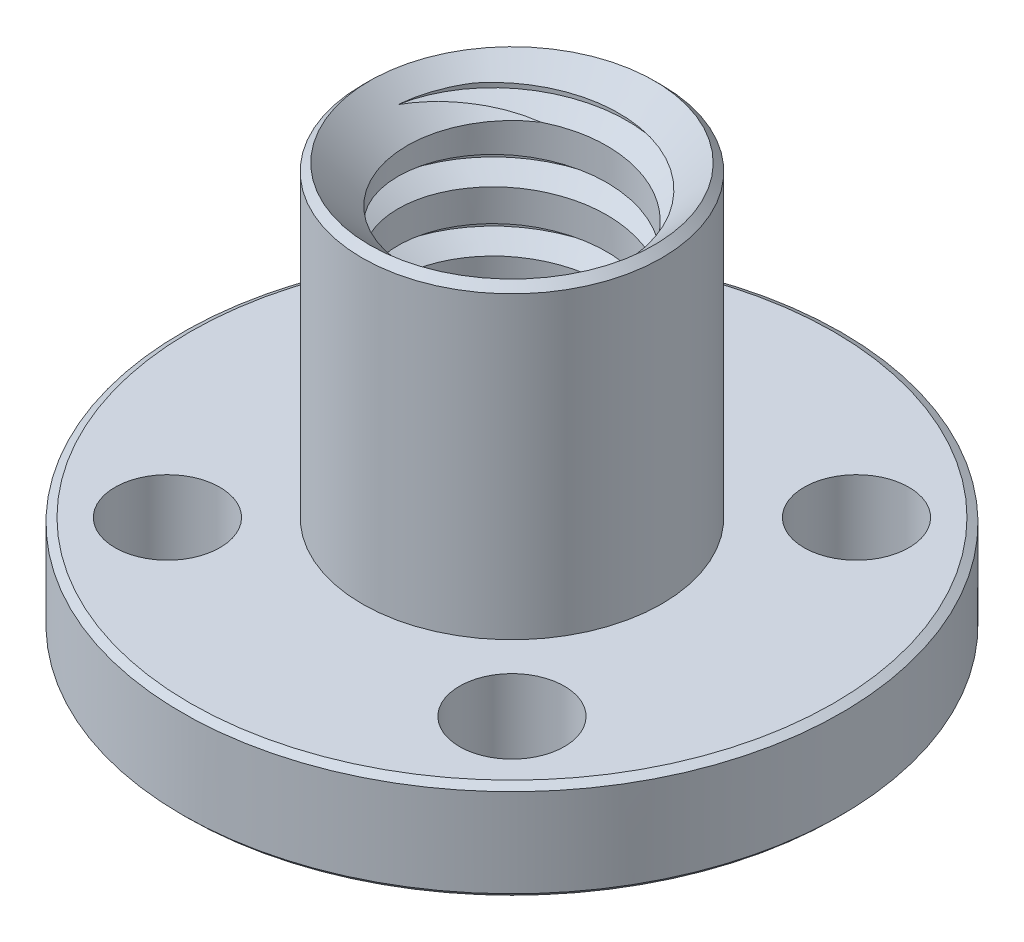
from build123d import *

# Parameters (mm, degrees)
SKETCH1_R           = 11
BOSS_EXTRUDE1_DEPTH = 3.25
SKETCH2_R           = 5
BOSS_EXTRUDE2_DEPTH = 1.5
BOSS_EXTRUDE3_START = 10.25
SKETCH3_R           = 5
BOSS_EXTRUDE3_DEPTH = 10.25
SKETCH4_R           = 1.75
CUT_EXTRUDE1_DEPTH  = 3.25
SKETCH5_R           = 3.5
CUT_EXTRUDE2_DEPTH  = 15
CHAMFER1_SIZE       = 0.25
CHAMFER2_SIZE       = 0.15
CHAMFER2_SIZE2      = 0.259807621
CHAMFER3_SIZE       = 0.15
THREAD1_PITCH       = 2


with BuildPart() as part:
    # Sketch1 → Boss-Extrude1 (new body)
    with BuildSketch(Plane(origin=(0, 0, 0), x_dir=(1, 0, 0), z_dir=(0, 1, 0))):
        with Locations(Location((0, 0, 0), (0, 0, 90))):
            Circle(SKETCH1_R)
    extrude(amount=BOSS_EXTRUDE1_DEPTH)

    # Sketch2 → Boss-Extrude2 (add)
    with BuildSketch(Plane.XZ):
        with Locations(Location((0, 0, 0), (0, 0, 270))):
            Circle(SKETCH2_R)
    extrude(amount=BOSS_EXTRUDE2_DEPTH)

    # Sketch3 → Boss-Extrude3 (add)
    with BuildSketch(Plane(origin=(0, 3.25, 0), x_dir=(1, 0, 0), z_dir=(0, 1, 0)).offset(BOSS_EXTRUDE3_START)):
        with Locations(Location((0, 0, 0), (0, 0, 90))):
            Circle(SKETCH3_R)
    extrude(amount=-BOSS_EXTRUDE3_DEPTH)

    # Sketch4 → Cut-Extrude1 (cut)
    with BuildSketch(Plane(origin=(0, 3.25, 0), x_dir=(1, 0, 0), z_dir=(0, 1, 0))):
        with Locations(Location((-5.75, -5.75, 0), (0, 0, 270))):
            Circle(SKETCH4_R)
        with Locations(Location((-5.75, 5.75, 0), (0, 0, 270))):
            Circle(SKETCH4_R)
        with Locations(Location((5.75, 5.75, 0), (0, 0, 270))):
            Circle(SKETCH4_R)
        with Locations(Location((5.75, -5.75, 0), (0, 0, 270))):
            Circle(SKETCH4_R)
    extrude(amount=-CUT_EXTRUDE1_DEPTH, mode=Mode.SUBTRACT)

    # Sketch5 → Cut-Extrude2 (cut)
    with BuildSketch(Plane(origin=(0, 13.5, 0), x_dir=(1, 0, 0), z_dir=(0, 1, 0))):
        with Locations(Location((0, 0, 0), (0, 0, 270))):
            Circle(SKETCH5_R)
    extrude(amount=-CUT_EXTRUDE2_DEPTH, mode=Mode.SUBTRACT)

    # Chamfer1
    chamfer1_edges = [part.edges().sort_by_distance(p)[0] for p in [
        (0, 13.5, 5),
    ]]
    chamfer(chamfer1_edges, length=CHAMFER1_SIZE)

    # Chamfer2
    chamfer2_edges = [part.edges().sort_by_distance(p)[0] for p in [
        (0, 3.25, 11),
    ]]
    chamfer2_side = [part.faces().sort_by_distance(p)[0] for p in [
        (0, 1.625, 11),
    ]]
    chamfer(chamfer2_edges, length=CHAMFER2_SIZE, length2=CHAMFER2_SIZE2, reference=chamfer2_side[0])

    # Chamfer3
    chamfer3_edges = [part.edges().sort_by_distance(p)[0] for p in [
        (0, 0, 11),
    ]]
    chamfer(chamfer3_edges, length=CHAMFER3_SIZE)

    # Thread1: the profile of Thread Profile2 profile screwed along a right-hand helix of 8.75 turns, 10 arcs to a turn; built about Z, then put on its axis
    thread1_z = Axis((0, 0, 0), (0, 0, 1))
    thread1_corners = [(3.4997, 0, -0.000173205), (4.176582344, 0, 0.390624998), (4.176582344, 0, 0.546874998), (3.4997, 0, 0.937673202)]
    with BuildLine(mode=Mode.PRIVATE) as thread1_profile:
        Line(thread1_corners[0], thread1_corners[1])
        Line(thread1_corners[1], thread1_corners[2])
        Line(thread1_corners[2], thread1_corners[3])
        Line(thread1_corners[3], thread1_corners[0])
    thread1_cap = Face(thread1_profile.wire())
    thread1_turn_angles = [0, 18, 36, 54, 72, 90, 108, 126, 144, 162, 180, 198, 216, 234, 252, 270, 288, 306, 324, 342, 360]
    thread1_turn_weights = [1, 0.9510565162951535, 1, 0.9510565162951535, 1, 0.9510565162951535, 1, 0.9510565162951535, 1, 0.9510565162951535, 1, 0.9510565162951535, 1, 0.9510565162951535, 1, 0.9510565162951535, 1, 0.9510565162951535, 1, 0.9510565162951535, 1]
    thread1_turn_rails = [Edge.make_bspline([Vector(p[0], p[1], 0).rotate(thread1_z, thread1_turn_angles[k]) / thread1_turn_weights[k] + Vector(0, 0, p[2] + THREAD1_PITCH * thread1_turn_angles[k] / 360) for k in range(21)], [0, 0, 0, 1, 1, 2, 2, 3, 3, 4, 4, 5, 5, 6, 6, 7, 7, 8, 8, 9, 9, 10, 10, 10], 2, thread1_turn_weights) for p in thread1_corners]
    thread1_turn_sides = [Face.make_surface_from_curves(thread1_turn_rails[p[0]], thread1_turn_rails[p[1]]) for p in [(0, 1), (1, 2), (2, 3), (3, 0)]]
    thread1_last_angles = [2880, 2898, 2916, 2934, 2952, 2970, 2988, 3006, 3024, 3042, 3060, 3078, 3096, 3114, 3132, 3141, 3150]
    thread1_last_weights = [1, 0.9510565162951535, 1, 0.9510565162951535, 1, 0.9510565162951535, 1, 0.9510565162951535, 1, 0.9510565162951535, 1, 0.9510565162951535, 1, 0.9510565162951535, 1, 0.9876883405951378, 1]
    thread1_last_rails = [Edge.make_bspline([Vector(p[0], p[1], 0).rotate(thread1_z, thread1_last_angles[k]) / thread1_last_weights[k] + Vector(0, 0, p[2] + THREAD1_PITCH * thread1_last_angles[k] / 360) for k in range(17)], [0, 0, 0, 1, 1, 2, 2, 3, 3, 4, 4, 5, 5, 6, 6, 7, 7, 8, 8, 8], 2, thread1_last_weights) for p in thread1_corners]
    thread1_last_sides = [Face.make_surface_from_curves(thread1_last_rails[p[0]], thread1_last_rails[p[1]]) for p in [(0, 1), (1, 2), (2, 3), (3, 0)]]
    thread1 = Plane(origin=(0, 15.5, 0), x_dir=(-1, 0, 0), z_dir=(0, -1, 0)) * Solid(Shell([*[p.moved(Location((0, 0, THREAD1_PITCH * i))) for i in range(8) for p in thread1_turn_sides], *thread1_last_sides, thread1_cap, thread1_cap.rotate(thread1_z, 3150).moved(Location((0, 0, THREAD1_PITCH * 3150 / 360)))]))
    add(thread1, mode=Mode.SUBTRACT)

    # Cut-Extrude3 cone 1 section (through the dimple's axis) → Cut-Extrude3 (revolve, cut)
    with BuildSketch(Plane(origin=(0, 13.5, 0), x_dir=(0, 0, 1), z_dir=(1, 0, 0))):
        Polygon((0, 0), (4.75, 0), (0, 4.75), align=None)
    revolve(axis=Axis((0, 13.5, 0), (0, -1, 0)), mode=Mode.SUBTRACT)

    # Cut-Extrude4 cone 1 section (through the dimple's axis) → Cut-Extrude4 (revolve, cut)
    with BuildSketch(Plane(origin=(0, -1.5, 0), x_dir=(0, 0, -1), z_dir=(1, 0, 0))):
        Polygon((0, 0), (4.5, 0), (0, 4.5), align=None)
    revolve(axis=Axis((0, -1.5, 0), (0, 1, 0)), mode=Mode.SUBTRACT)


solid = part.part
